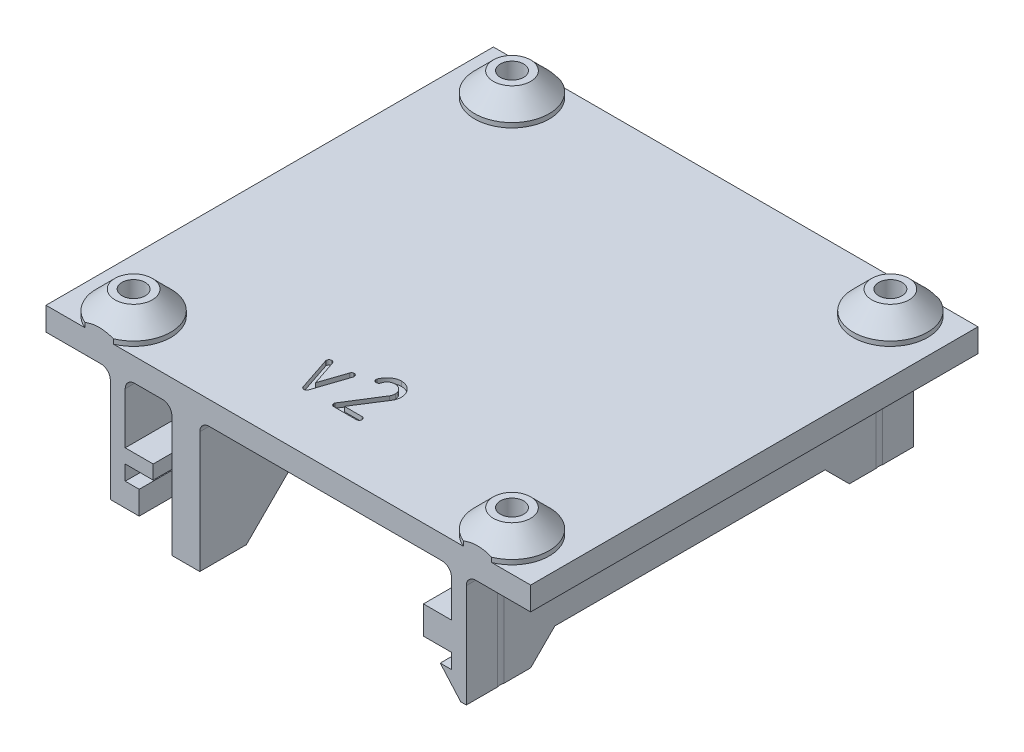
from build123d import *

# Parameters (mm, degrees)
MAINBOSS_DEPTH             = 24
SKETCH6_R                  = 4
MOUNDS_DEPTH               = 2.5
CUT_4HOLES_DEPTH           = 40.226776569
CUT_4HOLES_DEPTH_BACK      = 40.226776569
SKETCH5_R                  = 1.25
CHAMF_MOUNDS_SIZE          = 2
REMOVE_MATERIAL_DEPTH      = 38.887860853
REMOVE_MATERIAL_DEPTH_BACK = 38.887860853
CUT_EXTRUDE1_DEPTH         = 38.887860853
CUT_EXTRUDE1_DEPTH_BACK    = 38.887860853
SKETCH8_OUTSIDE_W          = 65.334
SKETCH8_OUTSIDE_H          = 35.734
SKETCH8_OUTSIDE_W_2        = 48
SKETCH8_OUTSIDE_H_2        = 24.962114535
FILLET2_R                  = 1
VERSIONNO_DEPTH            = 0.5


with BuildPart() as part:
    # Sketch1 → mainBoss (new, symmetric)
    with BuildSketch(Plane.XY):
        Polygon((-17.5, 0), (-17.5, -1.6), (-16, -1.6), (-16, -4.1), (-19.1, -4.1), (-19.1, 8), (-26, 8), (-26, 10.5), (26, 10.5), (26, 8), (19.1, 8), (19.1, -4.1), (18.5, -4.1), (16.3, -1.6), (17.5, -1.6), (17.5, 0), (14.5, 0), (14.5, 3), (17.5, 3), (17.5, 8), (-9.5, 8), (-9.5, -6), (-12.5, -6), (-12.5, 8), (-17.5, 8), (-17.5, 1.5), (-14.5, 1.5), (-14.5, 0), align=None)
    extrude(amount=MAINBOSS_DEPTH, both=True)

    # Sketch6 → mounds (add)
    with BuildSketch(Plane(origin=(0, 10.5, 0), x_dir=(1, 0, 0), z_dir=(0, 1, 0))):
        with Locations(Location((-20.3, 20.3, 0), (0, 0, 112.331645009))):
            Circle(SKETCH6_R)
        with Locations(Location((20.3, 20.3, 0), (0, 0, 67.668354991))):
            Circle(SKETCH6_R)
        with Locations(Location((20.3, -20.3, 0), (0, 0, 247.668354991))):
            Circle(SKETCH6_R)
        with Locations(Location((-20.3, -20.3, 0), (0, 0, 292.331645009))):
            Circle(SKETCH6_R)
    extrude(amount=MOUNDS_DEPTH)

    # Sketch5 → cut_4holes (cut, two sides: drawn at the far end of the back side and taken through both)
    with BuildSketch(Plane(origin=(0, 10.5, 0), x_dir=(1, 0, 0), z_dir=(0, 1, 0)).offset(-CUT_4HOLES_DEPTH_BACK)):
        with Locations(Location((-20.3, 20.3, 0), (0, 0, 270))):
            Circle(SKETCH5_R)
        with Locations(Location((20.3, 20.3, 0), (0, 0, 270))):
            Circle(SKETCH5_R)
        with Locations(Location((20.3, -20.3, 0), (0, 0, 270))):
            Circle(SKETCH5_R)
        with Locations(Location((-20.3, -20.3, 0), (0, 0, 270))):
            Circle(SKETCH5_R)
    extrude(amount=CUT_4HOLES_DEPTH + CUT_4HOLES_DEPTH_BACK, mode=Mode.SUBTRACT)

    # chamf_mounds
    chamf_mounds_edges = [part.edges().sort_by_distance(p)[0] for p in [
        (-18.780131585, 13, -16.6),
        (18.780131585, 13, -16.6),
        (21.819868415, 13, 16.6),
        (-21.819868415, 13, 16.6),
    ]]
    chamfer(chamf_mounds_edges, length=CHAMF_MOUNDS_SIZE)

    # Sketch7 → remove material (cut, two sides: drawn at the far end of the back side and taken through both)
    with BuildSketch(Plane(origin=(0, 0, 0), x_dir=(0, 0, -1), z_dir=(1, 0, 0)).offset(-REMOVE_MATERIAL_DEPTH_BACK)):
        Polygon((-19, -6), (-14.5, -1.5), (14.5, -1.5), (19, -6), align=None)
        Polygon((-19, 7), (19, 7), (19, 6), (14.5, 1.5), (-14.5, 1.5), (-19, 6), align=None)
    extrude(amount=REMOVE_MATERIAL_DEPTH + REMOVE_MATERIAL_DEPTH_BACK, mode=Mode.SUBTRACT)

    # Sketch8 outside → Cut-Extrude1 (cut, two sides: drawn at the far end of the back side and taken through both)
    with BuildSketch(Plane(origin=(0, 0, 0), x_dir=(0, 0, -1), z_dir=(1, 0, 0)).offset(-CUT_EXTRUDE1_DEPTH_BACK)):
        with Locations((0, 3.5)):
            Rectangle(SKETCH8_OUTSIDE_W, SKETCH8_OUTSIDE_H)
        with Locations((0, 1.432279934)):
            Rectangle(SKETCH8_OUTSIDE_W_2, SKETCH8_OUTSIDE_H_2, mode=Mode.SUBTRACT)
    extrude(amount=CUT_EXTRUDE1_DEPTH + CUT_EXTRUDE1_DEPTH_BACK, mode=Mode.SUBTRACT)

    # Fillet2
    fillet2_edges = [part.edges().sort_by_distance(p)[0] for p in [
        (-19.1, 8, 22.325),
        (19.1, 8, 22.325),
        (17.5, 8, 0),
        (-9.5, 8, 0),
        (-12.5, 8, 0),
        (-17.5, 8, 0),
    ]]
    fillet(fillet2_edges, radius=FILLET2_R - 0.0001)  # a hair under: the kernel refuses the full size

    # version 2 → VersionNo (cut)
    with BuildSketch(Plane(origin=(0, 10.5, 0), x_dir=(1, 0, 0), z_dir=(0, 1, 0))):
        with BuildLine():
            add(Edge.make_bspline(
                [(-5.849706916, -14.084865663), (-5.847460475, -14.104295768), (-5.843109876, -14.141925322), (-5.830919535, -14.177780618), (-5.825023704, -14.195121951)],
                knots=[0, 0, 0, 0, 1.032704525, 2, 2, 2, 2], degree=3))
            Line((-5.825023704, -14.195121951), (-4.627443673, -17.77648509))
            add(Edge.make_bspline(
                [(-4.627443673, -17.77648509), (-4.614353164, -17.80789855), (-4.589436302, -17.867691862), (-4.521475938, -17.936414851), (-4.437751977, -17.983520924), (-4.374036588, -17.991953119), (-4.340877362, -17.996341463)],
                knots=[0, 0, 0, 0, 1.054683453, 2.007515722, 2.96305683, 4, 4, 4, 4], degree=3))
            add(Edge.make_bspline(
                [(-4.340877362, -17.996341463), (-4.306113951, -17.992026061), (-4.240070656, -17.983827687), (-4.153315022, -17.937212007), (-4.085143653, -17.867675055), (-4.060108877, -17.808089528), (-4.046974923, -17.776829268)],
                knots=[0, 0, 0, 0, 1.06836729, 2.029677035, 2.966312611, 4, 4, 4, 4], degree=3))
            Line((-4.046974923, -17.776829268), (-2.848839919, -14.194184689))
            add(Edge.make_bspline(
                [(-2.848839919, -14.194184689), (-2.844396404, -14.177105546), (-2.83511148, -14.141417907), (-2.833290359, -14.104576142), (-2.832340777, -14.085365854)],
                knots=[0, 0, 0, 0, 0.957146177, 2, 2, 2, 2], degree=3))
            add(Edge.make_bspline(
                [(-2.832340777, -14.085365854), (-2.833964159, -14.065295583), (-2.837105944, -14.026452945), (-2.855406341, -13.971225807), (-2.881823026, -13.920299891), (-2.920339443, -13.876818457), (-2.965615469, -13.84010539), (-3.016723436, -13.811121378), (-3.075007004, -13.79556053), (-3.115188989, -13.792057914), (-3.135999313, -13.790243902)],
                knots=[0, 0, 0, 0, 1.027789528, 1.989114056, 2.957849911, 3.946954469, 4.938684973, 5.935646619, 6.930867606, 8, 8, 8, 8], degree=3))
            add(Edge.make_bspline(
                [(-3.135999313, -13.790243902), (-3.169077186, -13.794763663), (-3.232444196, -13.803422132), (-3.317388177, -13.848700331), (-3.384033397, -13.918897605), (-3.409358886, -13.978585262), (-3.422584679, -14.009756098)],
                knots=[0, 0, 0, 0, 1.03692919, 1.986436811, 2.948451835, 4, 4, 4, 4], degree=3))
            Line((-3.422584679, -14.009756098), (-4.340844016, -16.742158918))
            Line((-4.340844016, -16.742158918), (-5.251219397, -14.00918326))
            add(Edge.make_bspline(
                [(-5.251219397, -14.00918326), (-5.264671073, -13.978195042), (-5.290569192, -13.918534329), (-5.358580393, -13.848247255), (-5.446540047, -13.803073446), (-5.512274977, -13.794676471), (-5.546974923, -13.790243902)],
                knots=[0, 0, 0, 0, 1.028913269, 1.980936724, 2.934183284, 4, 4, 4, 4], degree=3))
            add(Edge.make_bspline(
                [(-5.546974923, -13.790243902), (-5.566974187, -13.792076376), (-5.605949447, -13.795647563), (-5.662949264, -13.811347063), (-5.713845402, -13.840424361), (-5.760186323, -13.876727956), (-5.799762263, -13.920256963), (-5.827781722, -13.970899614), (-5.845794311, -14.02649028), (-5.848984873, -14.065308303), (-5.85063346, -14.085365854)],
                knots=[0, 0, 0, 0, 1.030543514, 2.008358934, 3.007991962, 4.018680577, 5.024181706, 6.005556065, 6.969456486, 8, 8, 8, 8], degree=3))
            Line((-5.85063346, -14.085365854), (-5.849706916, -14.084865663))
        make_face()
        with BuildLine():
            add(Edge.make_bspline(
                [(1.389205527, -14.274204459), (1.424347535, -14.213040732), (1.494796863, -14.090425559), (1.562597241, -13.889720748), (1.607237347, -13.686513454), (1.613416193, -13.549817015), (1.616439711, -13.482926829)],
                knots=[0, 0, 0, 0, 1.013787966, 2.032344872, 3.037159877, 4, 4, 4, 4], degree=3))
            add(Edge.make_bspline(
                [(1.616439711, -13.482926829), (1.613680106, -13.430814596), (1.608265103, -13.328557953), (1.584887594, -13.178610107), (1.547984075, -13.035463838), (1.499294819, -12.897993996), (1.437088185, -12.767004681), (1.360525549, -12.643426603), (1.272736511, -12.525954071), (1.17289098, -12.416717745), (1.063651452, -12.316885671), (0.94620474, -12.229040614), (0.822840432, -12.152878569), (0.69257853, -12.090006889), (0.555341863, -12.041677291), (0.412226511, -12.004708858), (0.262270243, -11.981349031), (0.160014765, -11.975931582), (0.107903126, -11.973170732)],
                knots=[0, 0, 0, 0, 1.058443009, 2.076917897, 3.073239101, 4.054247521, 5.031990651, 6.00955979, 6.999406302, 8.003719833, 9.008033365, 9.997879877, 10.975449016, 11.945752479, 12.926760899, 13.923082103, 14.941556991, 16, 16, 16, 16], degree=3))
            add(Edge.make_bspline(
                [(0.107903126, -11.973170732), (0.065984846, -11.974980276), (-0.01650093, -11.978541055), (-0.138472918, -11.994729369), (-0.256476601, -12.019963815), (-0.370179988, -12.05557393), (-0.479578778, -12.100219364), (-0.585908837, -12.151923211), (-0.687250505, -12.215034316), (-0.817288828, -12.309054976), (-0.966284598, -12.445681225), (-1.125786737, -12.629807676), (-1.265857369, -12.83478846), (-1.339044174, -12.984752566), (-1.376243216, -13.06097561)],
                knots=[0, 0, 0, 0, 0.775863489, 1.526725378, 2.27305486, 3.005618887, 3.727569145, 4.457348924, 5.189912951, 5.932977202, 7.423702791, 8.916361755, 10.432662988, 12, 12, 12, 12], degree=3))
            add(Edge.make_bspline(
                [(-1.376243216, -13.06097561), (-1.383861302, -13.079430084), (-1.399494984, -13.117301986), (-1.401053765, -13.158265668), (-1.401852972, -13.179268293)],
                knots=[0, 0, 0, 0, 0.974573408, 2, 2, 2, 2], degree=3))
            add(Edge.make_bspline(
                [(-1.401852972, -13.179268293), (-1.400213362, -13.20014003), (-1.3970385, -13.240555047), (-1.37907002, -13.297914792), (-1.352421118, -13.350415293), (-1.313810955, -13.394884812), (-1.269341436, -13.433494975), (-1.216840934, -13.460143878), (-1.159481189, -13.478112357), (-1.119066173, -13.481287219), (-1.098194435, -13.482926829)],
                knots=[0, 0, 0, 0, 1.052730986, 2.038457085, 3.010444171, 4, 4.989555829, 5.961542915, 6.947269014, 8, 8, 8, 8], degree=3))
            add(Edge.make_bspline(
                [(-1.098194435, -13.482926829), (-1.063490077, -13.478496474), (-0.99774679, -13.47010369), (-0.909844731, -13.424900995), (-0.841560857, -13.35466862), (-0.816238998, -13.294631773), (-0.803072484, -13.263414634)],
                knots=[0, 0, 0, 0, 1.065202536, 2.017899786, 2.969374635, 4, 4, 4, 4], degree=3))
            add(Edge.make_bspline(
                [(-0.803072484, -13.263414634), (-0.789809321, -13.213595688), (-0.763841951, -13.116057342), (-0.695138407, -12.982417094), (-0.60486066, -12.865891169), (-0.493930377, -12.768521591), (-0.368538422, -12.689069407), (-0.230540614, -12.631157468), (-0.081969759, -12.596513374), (0.02032391, -12.590747785), (0.072537272, -12.587804878)],
                knots=[0, 0, 0, 0, 1.030680226, 2.017923977, 2.987398872, 3.96827074, 4.96037523, 5.949767355, 6.953507688, 8, 8, 8, 8], degree=3))
            add(Edge.make_bspline(
                [(0.072537272, -12.587804878), (0.133928371, -12.594104007), (0.254152498, -12.606439789), (0.424826433, -12.662735093), (0.579181975, -12.748424787), (0.713755331, -12.862083858), (0.826621955, -12.996823449), (0.910051812, -13.15087421), (0.961083444, -13.321314239), (0.970272545, -13.440308357), (0.974976296, -13.501219512)],
                knots=[0, 0, 0, 0, 1.043300576, 2.043128441, 3.020592189, 4.018068269, 5.011134672, 5.981974443, 6.967005516, 8, 8, 8, 8], degree=3))
            add(Edge.make_bspline(
                [(0.974976296, -13.501219512), (0.973818574, -13.543229791), (0.971516531, -13.626764091), (0.945465195, -13.748637285), (0.907290534, -13.867125129), (0.868029989, -13.939948751), (0.848147028, -13.976829268)],
                knots=[0, 0, 0, 0, 1.010874498, 2.01004839, 2.992216505, 4, 4, 4, 4], degree=3))
            Line((0.848147028, -13.976829268), (-1.385057288, -17.531459604))
            add(Edge.make_bspline(
                [(-1.385057288, -17.531459604), (-1.398389115, -17.554157264), (-1.426135413, -17.601395804), (-1.432626915, -17.655854514), (-1.435999313, -17.684146341)],
                knots=[0, 0, 0, 0, 0.960980606, 2, 2, 2, 2], degree=3))
            add(Edge.make_bspline(
                [(-1.435999313, -17.684146341), (-1.434824029, -17.705015303), (-1.432524002, -17.74585578), (-1.41463082, -17.803682343), (-1.387781923, -17.856507249), (-1.349179496, -17.90098506), (-1.304701685, -17.939587487), (-1.251876778, -17.966436384), (-1.194050215, -17.984329567), (-1.153209738, -17.986629594), (-1.132340777, -17.987804878)],
                knots=[0, 0, 0, 0, 1.045974665, 2.046968367, 3.014737927, 4, 4.985262073, 5.953031633, 6.954025335, 8, 8, 8, 8], degree=3))
            Line((-1.132340777, -17.987804878), (1.278633642, -17.987804878))
            add(Edge.make_bspline(
                [(1.278633642, -17.987804878), (1.29909158, -17.986594806), (1.339515024, -17.984203789), (1.396951059, -17.966437747), (1.449776299, -17.93958712), (1.49425402, -17.90098516), (1.532856471, -17.856507223), (1.559705362, -17.80368235), (1.577598547, -17.745855778), (1.579898573, -17.705015302), (1.581073857, -17.684146341)],
                knots=[0, 0, 0, 0, 1.028290674, 2.031829889, 3.002060474, 3.989828055, 4.977595636, 5.947826221, 6.951365436, 8, 8, 8, 8], degree=3))
            add(Edge.make_bspline(
                [(1.581073857, -17.684146341), (1.579987628, -17.66325411), (1.577902439, -17.623148145), (1.559421198, -17.566686259), (1.532833774, -17.515370478), (1.494187353, -17.472159709), (1.44971699, -17.434644105), (1.39663411, -17.409417327), (1.339161944, -17.391200055), (1.298296857, -17.388953062), (1.277415321, -17.387804878)],
                knots=[0, 0, 0, 0, 1.058535215, 2.032026861, 2.993167411, 3.974516965, 4.958471876, 5.928450685, 6.941464785, 8, 8, 8, 8], degree=3))
            Line((1.277415321, -17.387804878), (-0.59269353, -17.387804878))
            Line((-0.59269353, -17.387804878), (1.389205527, -14.274204459))
        make_face()
    extrude(amount=-VERSIONNO_DEPTH, mode=Mode.SUBTRACT)


solid = part.part
